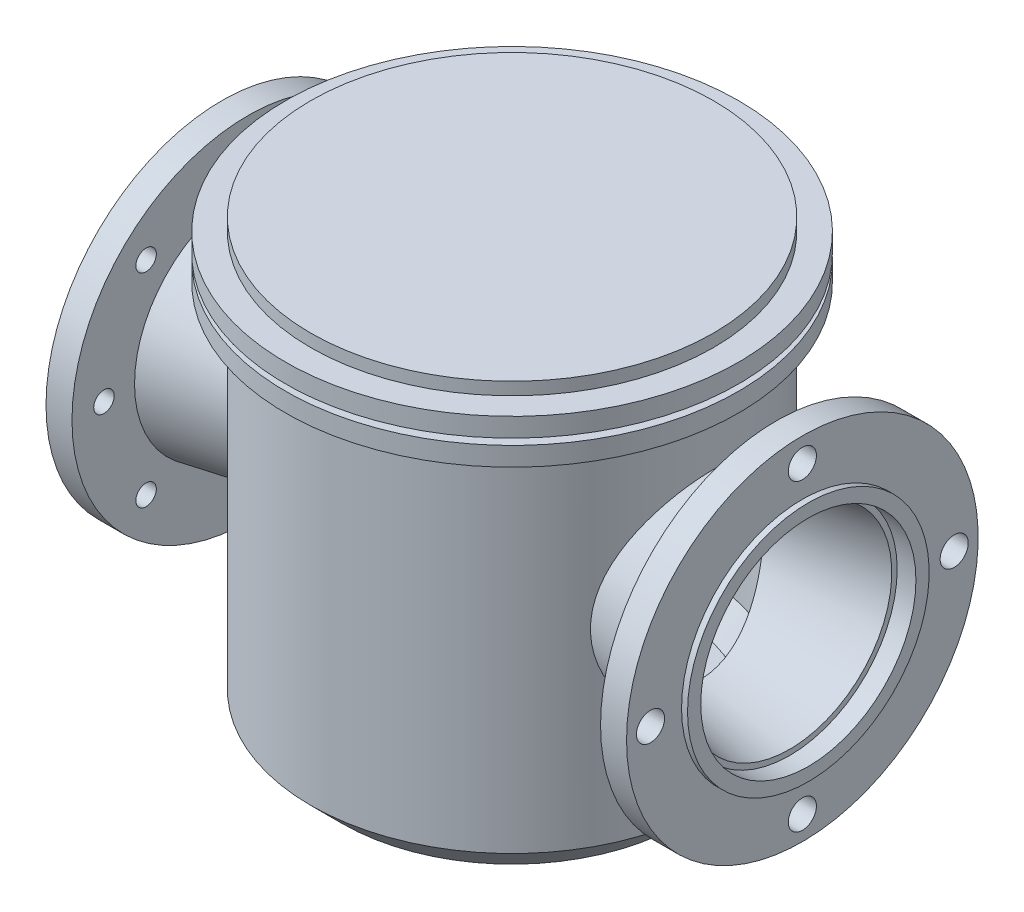
from build123d import *

# Parameters (mm, degrees)
SKETCH2_W                   = 20
SKETCH2_H                   = 15
SHELL1_START                = -39.5000001
SHELL1_OUTLINE_R            = 85.5
SHELL1_DEPTH                = 79.0000001
SHELL1_START_2              = -235.4
SHELL1_2_OUTLINE_R          = 85.5
SHELL1_2_DEPTH              = 14.9
SHELL1_START_3              = 220.5
SHELL1_3_OUTLINE_R          = 85.5
SHELL1_3_DEPTH              = 14.9
SHELL1_START_4              = -145.650757695
SHELL1_4_OUTLINE_R          = 149.5
SHELL1_4_DEPTH              = 310.150757695
SHELL1_START_5              = -174.5
SHELL1_5_OUTLINE_R          = 39.5
SHELL1_5_DEPTH              = 89
CUT_EXTRUDE1_REACH          = 534.755
SKETCH5_R                   = 11.175
CIRPATTERN1_COUNT           = 4
SKETCH15_R                  = 96
CUT_EXTRUDE4_DEPTH          = 4.75
SKETCH14_R                  = 39.5
EXTRUDE2_DEPTH              = 10
F_5_8_CLEARANCE_HOLE5_D     = 16.27124
F_5_8_CLEARANCE_HOLE5_DEPTH = 20.65


with BuildPart() as part:
    # Sketch1 → Base-Revolve (revolve)
    with BuildSketch(Plane.XY, mode=Mode.PRIVATE) as base_revolve_sk:
        Polygon((0, -185), (50, -185), (50, -175), (135, -175), (160, -150), (160, 175), (0, 175), align=None)
    revolve(base_revolve_sk.sketch.rotate(Axis((0, -64.079408138, 0), (0, 1, 0)), 90), axis=Axis((0, -64.079408138, 0), (0, 1, 0)))

    # Sketch2 → Boss-Revolve1 (revolve)
    with BuildSketch(Plane.XY, mode=Mode.PRIVATE) as boss_revolve1_sk:
        with Locations((170, 157.5)):
            Rectangle(SKETCH2_W, SKETCH2_H)
        with Locations((170, 137.5)):
            Rectangle(SKETCH2_W, SKETCH2_H)
    revolve(boss_revolve1_sk.sketch.rotate(Axis((0, 0, 0), (0, 1, 0)), 90), axis=Axis((0, 0, 0), (0, 1, 0)))

    # Sketch3 → Boss-Revolve2 (revolve)
    with BuildSketch(Plane.XY, mode=Mode.PRIVATE) as boss_revolve2_sk:
        Polygon((0, 0), (0, 52.971334051), (210, 90), (210, 139.7), (230.65, 139.7), (230.65, 96), (235.4, 96), (235.4, 0), align=None)
    boss_revolve2 = revolve(boss_revolve2_sk.sketch.rotate(Axis((0, 0, 0), (1, 0, 0)), 90), axis=Axis((0, 0, 0), (1, 0, 0)))

    # Mirror1: Boss-Revolve2 across plane
    add(boss_revolve2.mirror(Plane(origin=(0, 0, 0), x_dir=(0, 0, 1), z_dir=(1, 0, 0))))

    # Shell1: read off the stored shape, not the designer's step
    # Shell1 outline → Shell1 (cut)
    with BuildSketch(Plane.YZ.offset(SHELL1_START)):
        Circle(SHELL1_OUTLINE_R)
    extrude(amount=SHELL1_DEPTH, mode=Mode.SUBTRACT)

    # Shell1 2 outline → Shell1 2 (cut)
    with BuildSketch(Plane.YZ.offset(SHELL1_START_2)):
        Circle(SHELL1_2_OUTLINE_R)
    extrude(amount=SHELL1_2_DEPTH, mode=Mode.SUBTRACT)

    # Shell1 3 outline → Shell1 3 (cut)
    with BuildSketch(Plane.YZ.offset(SHELL1_START_3)):
        Circle(SHELL1_3_OUTLINE_R)
    extrude(amount=SHELL1_3_DEPTH, mode=Mode.SUBTRACT)

    # Shell1 4 outline → Shell1 4 (cut)
    with BuildSketch(Plane(origin=(0, 0, 0), x_dir=(1, 0, 0), z_dir=(0, 1, 0)).offset(SHELL1_START_4)):
        Circle(SHELL1_4_OUTLINE_R)
    extrude(amount=SHELL1_4_DEPTH, mode=Mode.SUBTRACT)

    # Shell1 5 outline → Shell1 5 (cut)
    with BuildSketch(Plane(origin=(0, 0, 0), x_dir=(1, 0, 0), z_dir=(0, 1, 0)).offset(SHELL1_START_5)):
        Circle(SHELL1_5_OUTLINE_R)
    extrude(amount=SHELL1_5_DEPTH, mode=Mode.SUBTRACT)

    # Shell1 6: loft between two sections, ruled curve by curve
    shell1_6_from = [
        Edge.make_three_point_arc((0, -164.5, 130.650757595), (130.650757595, -164.5, 0), (0, -164.5, -130.650757595)),
        Edge.make_three_point_arc((0, -164.5, -130.650757595), (-130.650757595, -164.5, 0), (0, -164.5, 130.650757595)),
    ]
    shell1_6_to = [
        Edge.make_three_point_arc((0, -145.650757595, 149.5), (149.5, -145.650757595, 0), (0, -145.650757595, -149.5)),
        Edge.make_three_point_arc((0, -145.650757595, -149.5), (-149.5, -145.650757595, 0), (0, -145.650757595, 149.5)),
    ]
    shell1_6 = Solid(Shell([*[Face.make_surface_from_curves(shell1_6_from[k], shell1_6_to[k]) for k in range(2)], Face(Wire(shell1_6_from)), Face(Wire(shell1_6_to))]))
    add(shell1_6, mode=Mode.SUBTRACT)

    # Shell1 7: loft between two sections, ruled curve by curve
    shell1_7_from = [
        Edge.make_three_point_arc((134.158642782, 41.530655606, 51.250412113), (134.158642782, -51.250412113, 41.530655606), (134.158642782, -41.530655606, -51.250412113)),
        Edge.make_three_point_arc((134.158642782, -41.530655606, -51.250412113), (134.158642782, 51.250412113, -41.530655606), (134.158642782, 41.530655606, 51.250412113)),
    ]
    shell1_7_to = [
        Edge.make_three_point_arc((220.5, 51.115651267, 63.078662127), (220.5, -63.078662127, 51.115651267), (220.5, -51.115651267, -63.078662127)),
        Edge.make_three_point_arc((220.5, -51.115651267, -63.078662127), (220.5, 63.078662127, -51.115651267), (220.5, 51.115651267, 63.078662127)),
    ]
    shell1_7 = Solid(Shell([*[Face.make_surface_from_curves(shell1_7_from[k], shell1_7_to[k]) for k in range(2)], Face(Wire(shell1_7_from)), Face(Wire(shell1_7_to))]))
    add(shell1_7, mode=Mode.SUBTRACT)

    # Shell1 8: loft between two sections, ruled curve by curve
    shell1_8_from = [
        Edge.make_three_point_arc((-134.158707207, 0, -65.965154404), (-134.158707207, -65.965154404, 0), (-134.158707207, 0, 65.965154404)),
        Edge.make_three_point_arc((-134.158707207, 0, 65.965154404), (-134.158707207, 65.965154404, 0), (-134.158707207, 0, -65.965154404)),
    ]
    shell1_8_to = [
        Edge.make_three_point_arc((-220.5, 0, -81.189453873), (-220.5, -81.189453873, 0), (-220.5, 0, 81.189453873)),
        Edge.make_three_point_arc((-220.5, 0, 81.189453873), (-220.5, 81.189453873, 0), (-220.5, 0, -81.189453873)),
    ]
    shell1_8 = Solid(Shell([*[Face.make_surface_from_curves(shell1_8_from[k], shell1_8_to[k]) for k in range(2)], Face(Wire(shell1_8_from)), Face(Wire(shell1_8_to))]))
    add(shell1_8, mode=Mode.SUBTRACT)

    # Sketch5 → Cut-Extrude1 (cut, up to next)
    with BuildSketch(Plane(origin=(230.65, 0, 0), x_dir=(0, 0, -1), z_dir=(1, 0, 0)), mode=Mode.PRIVATE) as cut_extrude1_sk1:
        with Locations((0, 120.65)):
            Circle(SKETCH5_R)
    cut_extrude1_tool1 = extrude(cut_extrude1_sk1.sketch, amount=-CUT_EXTRUDE1_REACH, mode=Mode.PRIVATE) & part.part
    cut_extrude1 = cut_extrude1_tool1.solids().sort_by_distance((230.65, 120.65, 0))[0]
    add(cut_extrude1, mode=Mode.SUBTRACT)

    # CirPattern1: Cut-Extrude1 ×4 about axis
    cirpattern1_axis = Axis((0, 0, 0), (1, 0, 0))
    for i in range(1, CIRPATTERN1_COUNT):
        add(cut_extrude1.rotate(cirpattern1_axis, i * 360 / CIRPATTERN1_COUNT), mode=Mode.SUBTRACT)

    # Sketch15 → Cut-Extrude4 (cut)
    with BuildSketch(Plane.ZY.offset(230.65)):
        Circle(SKETCH15_R)
    extrude(amount=CUT_EXTRUDE4_DEPTH, mode=Mode.SUBTRACT)

    # Sketch14 → Extrude2 (add)
    with BuildSketch(Plane(origin=(0, -174.5, 0), x_dir=(1, 0, 0), z_dir=(0, 1, 0))):
        Circle(SKETCH14_R)
    extrude(amount=EXTRUDE2_DEPTH)

    # 5/8 Clearance Hole5
    with Locations(Plane(origin=(-230.65, -86.94526051, 61.229912904), x_dir=(0, 0, 1), z_dir=(-1, 0, 0))):
        with Locations((-61.229912904, 201.24526051), (-176.596487394, 86.94526051), (-142.052217993, 167.767565599), (19.592392186, 167.767565599), (53.070087096, 86.94526051), (19.592392186, 6.12295542), (-61.229912904, -27.406492985), (-142.052217993, 6.12295542)):
            Hole(F_5_8_CLEARANCE_HOLE5_D / 2, depth=F_5_8_CLEARANCE_HOLE5_DEPTH)


solid = part.part
